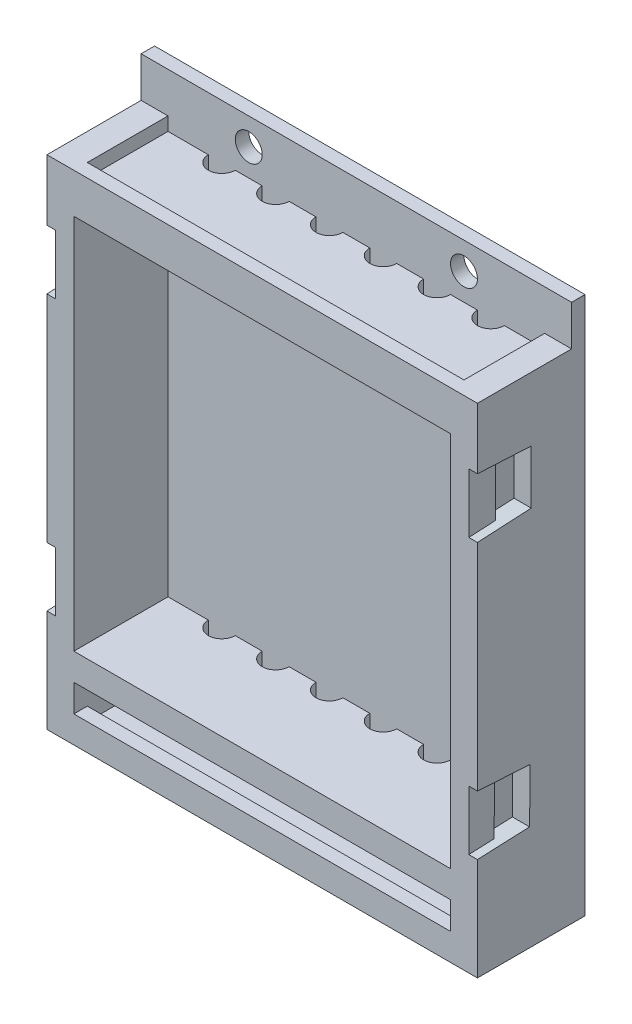
from build123d import *

# Parameters (mm, degrees)
SKETCH1_W            = 101.6
SKETCH1_H            = 127
BOSS_EXTRUDE1_DEPTH  = 3.175
SKETCH2_W            = 101.6
SKETCH2_H            = 117.475
BOSS_EXTRUDE2_DEPTH  = 22.225
SKETCH3_W            = 88.9
SKETCH3_H            = 19.05
CUT_EXTRUDE1_DEPTH   = 3.175
SKETCH4_R            = 3.175
CUT_EXTRUDE2_DEPTH   = 165.150877625
SKETCH5_W            = 88.9
SKETCH5_H            = 6.477782688
CUT_EXTRUDE3_DEPTH   = 22.225
SKETCH6_W            = 88.9
SKETCH6_H            = 19.05
CUT_EXTRUDE4_DEPTH   = 3.175
SKETCH7_W            = 88.9
SKETCH7_H            = 88.9
CUT_EXTRUDE6_DEPTH   = 22.225
CUT_EXTRUDE7_DEPTH   = 7.62
LPATTERN1_COUNT      = 6
LPATTERN1_PITCH      = 12.7
SNAP_START           = 99.568
SNAP_GROOVE1_DEPTH   = 2.032
SNAP_START_2         = 97.536
SNAP_GROOVE1_2_DEPTH = 2.032
MIRROR2_START        = 99.568
MIRROR2_COPY_1_DEPTH = 2.032
MIRROR2_START_2      = 97.536
MIRROR2_COPY_2_DEPTH = 2.032
MIRROR2_COPY_3_DEPTH = 2.032
CUT_EXTRUDE8_REACH   = 157.023
LPATTERN2_COUNT      = 6
LPATTERN2_PITCH      = 12.7


# Read off the part's stored shape, not the designer's step: Snap Groove1
with BuildPart() as part:
    # Sketch1 → Boss-Extrude1 (new body)
    with BuildSketch(Plane.XY):
        with Locations((50.8, 63.5)):
            Rectangle(SKETCH1_W, SKETCH1_H)
    extrude(amount=BOSS_EXTRUDE1_DEPTH)

    # Sketch2 → Boss-Extrude2 (add)
    with BuildSketch(Plane.XY.offset(3.175)):
        with Locations((50.8, 58.7375)):
            Rectangle(SKETCH2_W, SKETCH2_H)
    extrude(amount=BOSS_EXTRUDE2_DEPTH)

    # Sketch3 → Cut-Extrude1 (cut)
    with BuildSketch(Plane(origin=(0, 117.475, 0), x_dir=(1, 0, 0), z_dir=(0, 1, 0))):
        with Locations((50.8, -12.7)):
            Rectangle(SKETCH3_W, SKETCH3_H)
    extrude(amount=-CUT_EXTRUDE1_DEPTH, mode=Mode.SUBTRACT)

    # Sketch4 → Cut-Extrude2 (cut, through all)
    with BuildSketch(Plane.XY.offset(3.175)):
        with Locations((25.4, 120.65)):
            Circle(SKETCH4_R)
        with Locations((76.2, 120.65)):
            Circle(SKETCH4_R)
    extrude(amount=-CUT_EXTRUDE2_DEPTH, mode=Mode.SUBTRACT)

    # Sketch5 → Cut-Extrude3 (cut)
    with BuildSketch(Plane.XY.offset(25.4)):
        with Locations((50.8, 9.588891344)):
            Rectangle(SKETCH5_W, SKETCH5_H)
    extrude(amount=-CUT_EXTRUDE3_DEPTH, mode=Mode.SUBTRACT)

    # Sketch6 → Cut-Extrude4 (cut)
    with BuildSketch(Plane(origin=(0, 6.35, 0), x_dir=(1, 0, 0), z_dir=(0, 1, 0))):
        with Locations((50.8, -12.7)):
            Rectangle(SKETCH6_W, SKETCH6_H)
    extrude(amount=-CUT_EXTRUDE4_DEPTH, mode=Mode.SUBTRACT)

    # Sketch7 → Cut-Extrude6 (cut)
    with BuildSketch(Plane.XY.offset(25.4)):
        with Locations((50.8, 63.627782688)):
            Rectangle(SKETCH7_W, SKETCH7_H)
    extrude(amount=-CUT_EXTRUDE6_DEPTH, mode=Mode.SUBTRACT)

    # Sketch9 → Cut-Extrude7 (cut)
    with BuildSketch(Plane(origin=(0, 19.177782688, 0), x_dir=(1, 0, 0), z_dir=(0, 1, 0))):
        with BuildLine():
            Line((15.875, -3.175), (22.225, -3.175))
            ThreePointArc((22.225, -3.175), (19.05, -6.35), (15.875, -3.175))
        make_face()
    cut_extrude7 = extrude(amount=-CUT_EXTRUDE7_DEPTH, mode=Mode.SUBTRACT)

    # LPattern1: Cut-Extrude7 ×6
    with Locations(*[(i * LPATTERN1_PITCH, 0, 0) for i in range(1, LPATTERN1_COUNT)]):
        add(cut_extrude7, mode=Mode.SUBTRACT)

    # Snap Groove1 outline → Snap Groove1 (cut)
    with BuildSketch(Plane.YZ.offset(SNAP_START)):
        Polygon((102.39375, 12.7), (103.059328797, 25.4), (89.028171203, 25.4), (89.69375, 12.7), align=None)
    snap_groove1 = extrude(amount=SNAP_GROOVE1_DEPTH, mode=Mode.SUBTRACT)

    # Snap Groove1 2 outline → Snap Groove1 2 (cut)
    with BuildSketch(Plane.YZ.offset(SNAP_START_2)):
        Polygon((102.39375, 12.7), (102.726539398, 19.05), (89.360960602, 19.05), (89.69375, 12.7), align=None)
    snap_groove1_2 = extrude(amount=SNAP_GROOVE1_2_DEPTH, mode=Mode.SUBTRACT)

    # Mirror1: Snap Groove1, Snap Groove1 2 across plane
    add(snap_groove1.mirror(Plane(origin=(50.8, 0, 0), x_dir=(0, 0, 1), z_dir=(1, 0, 0))), mode=Mode.SUBTRACT)
    add(snap_groove1_2.mirror(Plane(origin=(50.8, 0, 0), x_dir=(0, 0, 1), z_dir=(1, 0, 0))), mode=Mode.SUBTRACT)

    # Mirror2: Snap Groove1, Snap Groove1 2 across plane
    add(snap_groove1.mirror(Plane(origin=(0, 63.498392913, -0.319448634), x_dir=(0, 0.005030750815786494, 0.999987345693049), z_dir=(0, -0.9999873456930491, 0.0050307508157864935))), mode=Mode.SUBTRACT)
    add(snap_groove1_2.mirror(Plane(origin=(0, 63.498392913, -0.319448634), x_dir=(0, 0.005030750815786494, 0.999987345693049), z_dir=(0, -0.9999873456930491, 0.0050307508157864935))), mode=Mode.SUBTRACT)

    # Mirror2 copy 1 sketch → Mirror2 copy 1 (cut)
    with BuildSketch(Plane(origin=(101.6, 126.996785826, -0.638897269), x_dir=(0, -0.9999493830924595, 0.010061374310242954), z_dir=(-1, 0, 0)).offset(MIRROR2_START)):
        Polygon((102.39375, 12.7), (103.059328797, 25.4), (89.028171203, 25.4), (89.69375, 12.7), align=None)
    extrude(amount=MIRROR2_COPY_1_DEPTH, mode=Mode.SUBTRACT)

    # Mirror2 copy 2 sketch → Mirror2 copy 2 (cut)
    with BuildSketch(Plane(origin=(101.6, 126.996785826, -0.638897269), x_dir=(0, -0.9999493830924595, 0.010061374310242954), z_dir=(-1, 0, 0)).offset(MIRROR2_START_2)):
        Polygon((102.39375, 12.7), (102.726539398, 19.05), (89.360960602, 19.05), (89.69375, 12.7), align=None)
    extrude(amount=MIRROR2_COPY_2_DEPTH, mode=Mode.SUBTRACT)

    # Mirror2 copy 3 sketch → Mirror2 copy 3 (cut)
    with BuildSketch(Plane(origin=(0, 126.996785826, -0.638897269), x_dir=(0, -0.9999493830924595, 0.010061374310242954), z_dir=(1, 0, 0)).offset(MIRROR2_START_2)):
        Polygon((102.39375, -12.7), (102.726539398, -19.05), (89.360960602, -19.05), (89.69375, -12.7), align=None)
    extrude(amount=MIRROR2_COPY_3_DEPTH, mode=Mode.SUBTRACT)

    # Sketch11 → Cut-Extrude8 (cut, up to next)
    with BuildSketch(Plane(origin=(0, 114.3, 0), x_dir=(1, 0, 0), z_dir=(0, 1, 0)), mode=Mode.PRIVATE) as cut_extrude8_sk1:
        with BuildLine():
            Line((15.875, -3.175), (22.225, -3.175))
            ThreePointArc((22.225, -3.175), (19.05, -6.35), (15.875, -3.175))
        make_face()
    cut_extrude8_tool1 = extrude(cut_extrude8_sk1.sketch, amount=-CUT_EXTRUDE8_REACH, mode=Mode.PRIVATE) & part.part
    cut_extrude8 = cut_extrude8_tool1.solids().sort_by_distance((19.05, 114.3, 4.522512))[0]
    add(cut_extrude8, mode=Mode.SUBTRACT)

    # LPattern2: Cut-Extrude8 ×6
    with Locations(*[(i * LPATTERN2_PITCH, 0, 0) for i in range(1, LPATTERN2_COUNT)]):
        add(cut_extrude8, mode=Mode.SUBTRACT)


solid = part.part
